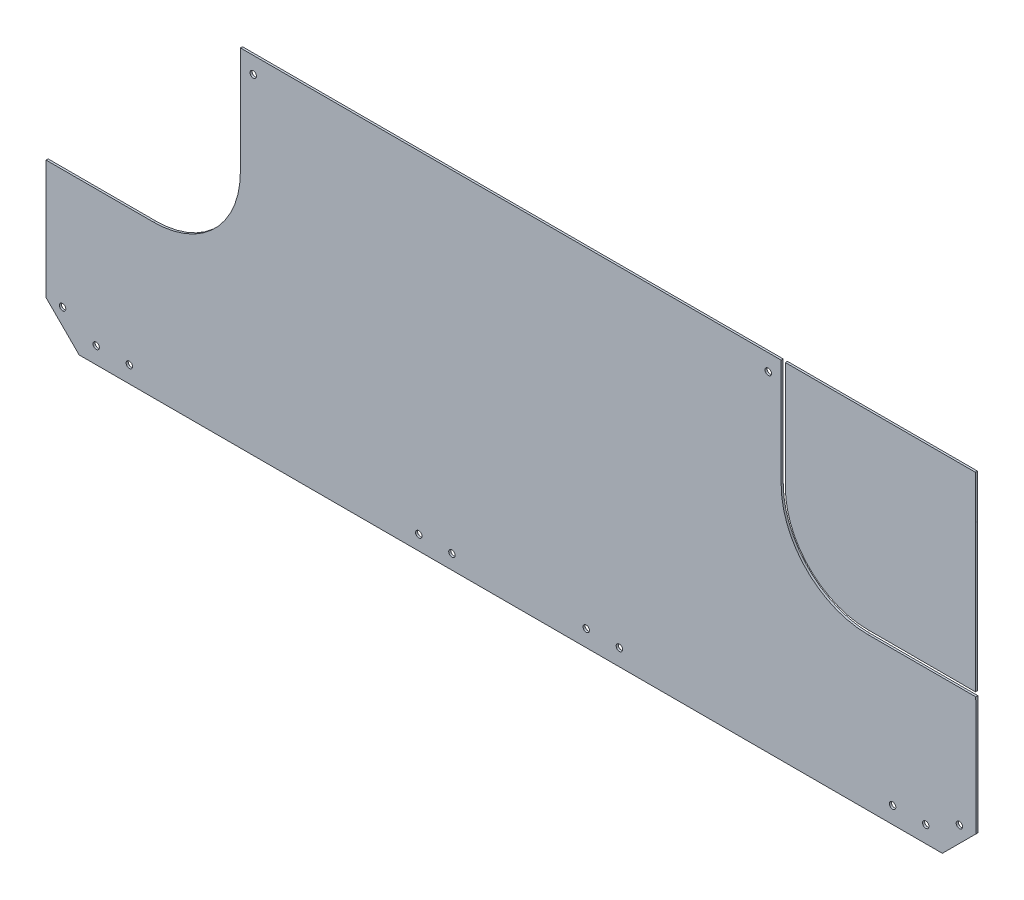
from build123d import *

# Parameters (mm, degrees)
SKETCH3_W                              = 914.4
SKETCH3_H                              = 609.6
BOSS_EXTRUDE1_DEPTH                    = 0.79375
CUT_EXTRUDE1_DEPTH                     = 2.54
CUT_EXTRUDE2_DEPTH                     = 2.54
CUT_EXTRUDE3_DEPTH                     = 2.54
SKETCH11_W                             = 2.45745
SKETCH11_H                             = 1.5875
F_10_0_1935_DIAMETER_HOLE1_AT_2_COUNT  = 2
F_10_0_1935_DIAMETER_HOLE1_AT_2_PITCH  = 25.4
F_10_0_1935_DIAMETER_HOLE1_AT_3_COUNT  = 2
F_10_0_1935_DIAMETER_HOLE1_AT_3_PITCH  = 52.708494186
F_10_0_1935_DIAMETER_HOLE1_AT_4_COUNT  = 2
F_10_0_1935_DIAMETER_HOLE1_AT_4_PITCH  = 221.646085603
F_10_0_1935_DIAMETER_HOLE1_AT_5_COUNT  = 2
F_10_0_1935_DIAMETER_HOLE1_AT_5_PITCH  = 247.04550109
F_10_0_1935_DIAMETER_HOLE1_AT_6_COUNT  = 2
F_10_0_1935_DIAMETER_HOLE1_AT_6_PITCH  = 349.910400508
F_10_0_1935_DIAMETER_HOLE1_AT_7_COUNT  = 2
F_10_0_1935_DIAMETER_HOLE1_AT_7_PITCH  = 375.310400508
F_10_0_1935_DIAMETER_HOLE1_AT_8_COUNT  = 2
F_10_0_1935_DIAMETER_HOLE1_AT_8_PITCH  = 609.955600508
F_10_0_1935_DIAMETER_HOLE1_AT_9_COUNT  = 2
F_10_0_1935_DIAMETER_HOLE1_AT_9_PITCH  = 584.555600508
F_10_0_1935_DIAMETER_HOLE1_AT_10_COUNT = 2
F_10_0_1935_DIAMETER_HOLE1_AT_10_PITCH = 635.838045264
F_10_0_1935_DIAMETER_HOLE1_AT_11_COUNT = 2
F_10_0_1935_DIAMETER_HOLE1_AT_11_PITCH = 545.026051512
F_10_0_1935_DIAMETER_HOLE1_AT_12_COUNT = 2
F_10_0_1935_DIAMETER_HOLE1_AT_12_PITCH = 258.142956966


with BuildPart() as part:
    # Sketch3 → Boss-Extrude1 (new, symmetric)
    with BuildSketch(Plane.XY):
        Rectangle(SKETCH3_W, SKETCH3_H)
    extrude(amount=BOSS_EXTRUDE1_DEPTH, both=True)

    # Sketch4 → Cut-Extrude1 (cut)
    with BuildSketch(Plane.XY.offset(0.79375)):
        Polygon((-378.246738216, -279.4), (-378.246738216, -39.370452154), (333.614037385, -39.370452154), (333.980724384, -279.084337387), (308.265061771, -304.8), (334.020061276, -304.8), (457.2, -304.8), (457.2, 304.8), (-457.2, 304.8), (-457.2, -304.8), (-378.246738216, -304.8), (-352.846738216, -304.8), align=None)
    extrude(amount=-CUT_EXTRUDE1_DEPTH, mode=Mode.SUBTRACT)

    # Sketch7 → Cut-Extrude2 (cut)
    with BuildSketch(Plane.XY.offset(0.79375)):
        with BuildLine():
            Line((-378.246738216, -188.190344021), (-378.246738216, -39.346344021))
            Line((-378.246738216, -39.346344021), (-229.402738216, -39.346344021))
            Line((-229.402738216, -39.346344021), (-229.402738216, -64.746344021))
            Line((-229.402738216, -64.746344021), (-229.402738216, -121.896344021))
            ThreePointArc((-229.402738216, -121.896344021), (-248.819801264, -168.773280973), (-295.696738216, -188.190344021))
            Line((-295.696738216, -188.190344021), (-352.846738216, -188.190344021))
            Line((-352.846738216, -188.190344021), (-378.246738216, -188.190344021))
        make_face()
    extrude(amount=-CUT_EXTRUDE2_DEPTH, mode=Mode.SUBTRACT)

    # Sketch8 → Cut-Extrude3 (cut)
    with BuildSketch(Plane.XY.offset(0.79375)):
        with BuildLine():
            Line((251.115061771, -188.190344021), (336.840061771, -188.190344021))
            Line((336.840061771, -188.190344021), (336.840061771, -36.171344021))
            Line((336.840061771, -36.171344021), (184.821061771, -36.171344021))
            Line((184.821061771, -36.171344021), (184.821061771, -121.896344021))
            ThreePointArc((184.821061771, -121.896344021), (204.238124819, -168.773280973), (251.115061771, -188.190344021))
        make_face()
        with BuildLine():
            Line((251.115061771, -185.015344021), (333.665061771, -185.015344021))
            Line((333.665061771, -185.015344021), (333.665061771, -39.346344021))
            Line((333.665061771, -39.346344021), (187.996061771, -39.346344021))
            Line((187.996061771, -39.346344021), (187.996061771, -121.896344021))
            ThreePointArc((187.996061771, -121.896344021), (206.483188849, -166.528216943), (251.115061771, -185.015344021))
        make_face(mode=Mode.SUBTRACT)
    extrude(amount=-CUT_EXTRUDE3_DEPTH, mode=Mode.SUBTRACT)


with BuildPart() as cut_extrude3_piece_1:
    # of the separate pieces the step leaves, piece 1, a body of its own (cut_extrude3_pieces)
    add(part.part.solids().sort_by_distance((308.265061771, -304.8, 0.79375))[0])

    # Sketch11 → #10 (0.1935) Diameter Hole1 (revolve, cut)
    with BuildSketch(Plane(origin=(-314.391138724, -292.114748821, 0.79375), x_dir=(0, -1, 0), z_dir=(1, 0, 0))):
        with Locations((1.228725, 0.79375)):
            Rectangle(SKETCH11_W, SKETCH11_H)
    f_10_0_1935_diameter_hole1 = revolve(axis=Axis((-314.391138724, -292.114748821, 7.14375), (0, 0, -1)), mode=Mode.SUBTRACT)

    # #10 (0.1935) Diameter Hole1 at 2: #10 (0.1935) Diameter Hole1 ×2
    with Locations(*[(-i * F_10_0_1935_DIAMETER_HOLE1_AT_2_PITCH, 0, 0) for i in range(1, F_10_0_1935_DIAMETER_HOLE1_AT_2_COUNT)]):
        add(f_10_0_1935_diameter_hole1, mode=Mode.SUBTRACT)

    # #10 (0.1935) Diameter Hole1 at 3: #10 (0.1935) Diameter Hole1 ×2
    with Locations(*[Vector(-0.9705380561850375, 0.2409478812867402, 0) * (i * F_10_0_1935_DIAMETER_HOLE1_AT_3_PITCH) for i in range(1, F_10_0_1935_DIAMETER_HOLE1_AT_3_COUNT)]):
        add(f_10_0_1935_diameter_hole1, mode=Mode.SUBTRACT)

    # #10 (0.1935) Diameter Hole1 at 4: #10 (0.1935) Diameter Hole1 ×2
    with Locations(*[Vector(0.9999743505739794, -0.007162275765998663, 0) * (i * F_10_0_1935_DIAMETER_HOLE1_AT_4_PITCH) for i in range(1, F_10_0_1935_DIAMETER_HOLE1_AT_4_COUNT)]):
        add(f_10_0_1935_diameter_hole1, mode=Mode.SUBTRACT)

    # #10 (0.1935) Diameter Hole1 at 5: #10 (0.1935) Diameter Hole1 ×2
    with Locations(*[Vector(0.9999793536731977, -0.006425902841934069, 0) * (i * F_10_0_1935_DIAMETER_HOLE1_AT_5_PITCH) for i in range(1, F_10_0_1935_DIAMETER_HOLE1_AT_5_COUNT)]):
        add(f_10_0_1935_diameter_hole1, mode=Mode.SUBTRACT)

    # #10 (0.1935) Diameter Hole1 at 6: #10 (0.1935) Diameter Hole1 ×2
    with Locations(*[(i * F_10_0_1935_DIAMETER_HOLE1_AT_6_PITCH, 0, 0) for i in range(1, F_10_0_1935_DIAMETER_HOLE1_AT_6_COUNT)]):
        add(f_10_0_1935_diameter_hole1, mode=Mode.SUBTRACT)

    # #10 (0.1935) Diameter Hole1 at 7: #10 (0.1935) Diameter Hole1 ×2
    with Locations(*[(i * F_10_0_1935_DIAMETER_HOLE1_AT_7_PITCH, 0, 0) for i in range(1, F_10_0_1935_DIAMETER_HOLE1_AT_7_COUNT)]):
        add(f_10_0_1935_diameter_hole1, mode=Mode.SUBTRACT)

    # #10 (0.1935) Diameter Hole1 at 8: #10 (0.1935) Diameter Hole1 ×2
    with Locations(*[(i * F_10_0_1935_DIAMETER_HOLE1_AT_8_PITCH, 0, 0) for i in range(1, F_10_0_1935_DIAMETER_HOLE1_AT_8_COUNT)]):
        add(f_10_0_1935_diameter_hole1, mode=Mode.SUBTRACT)

    # #10 (0.1935) Diameter Hole1 at 9: #10 (0.1935) Diameter Hole1 ×2
    with Locations(*[(i * F_10_0_1935_DIAMETER_HOLE1_AT_9_PITCH, 0, 0) for i in range(1, F_10_0_1935_DIAMETER_HOLE1_AT_9_COUNT)]):
        add(f_10_0_1935_diameter_hole1, mode=Mode.SUBTRACT)

    # #10 (0.1935) Diameter Hole1 at 10: #10 (0.1935) Diameter Hole1 ×2
    with Locations(*[Vector(0.9998005069605744, 0.01997363966277868, 0) * (i * F_10_0_1935_DIAMETER_HOLE1_AT_10_PITCH) for i in range(1, F_10_0_1935_DIAMETER_HOLE1_AT_10_COUNT)]):
        add(f_10_0_1935_diameter_hole1, mode=Mode.SUBTRACT)

    # #10 (0.1935) Diameter Hole1 at 11: #10 (0.1935) Diameter Hole1 ×2
    with Locations(*[Vector(0.8977666281056725, 0.44047143092347246, 0) * (i * F_10_0_1935_DIAMETER_HOLE1_AT_11_PITCH) for i in range(1, F_10_0_1935_DIAMETER_HOLE1_AT_11_COUNT)]):
        add(f_10_0_1935_diameter_hole1, mode=Mode.SUBTRACT)

    # #10 (0.1935) Diameter Hole1 at 12: #10 (0.1935) Diameter Hole1 ×2
    with Locations(*[Vector(0.3676040656829352, 0.929982392786754, 0) * (i * F_10_0_1935_DIAMETER_HOLE1_AT_12_PITCH) for i in range(1, F_10_0_1935_DIAMETER_HOLE1_AT_12_COUNT)]):
        add(f_10_0_1935_diameter_hole1, mode=Mode.SUBTRACT)


with BuildPart() as cut_extrude3_piece_2:
    # of the separate pieces the step leaves, piece 2, a body of its own (cut_extrude3_pieces)
    add(part.part.solids().sort_by_distance((333.614037385, -39.370452154, 0.79375))[0])


solid = Compound([cut_extrude3_piece_1.part, cut_extrude3_piece_2.part])
